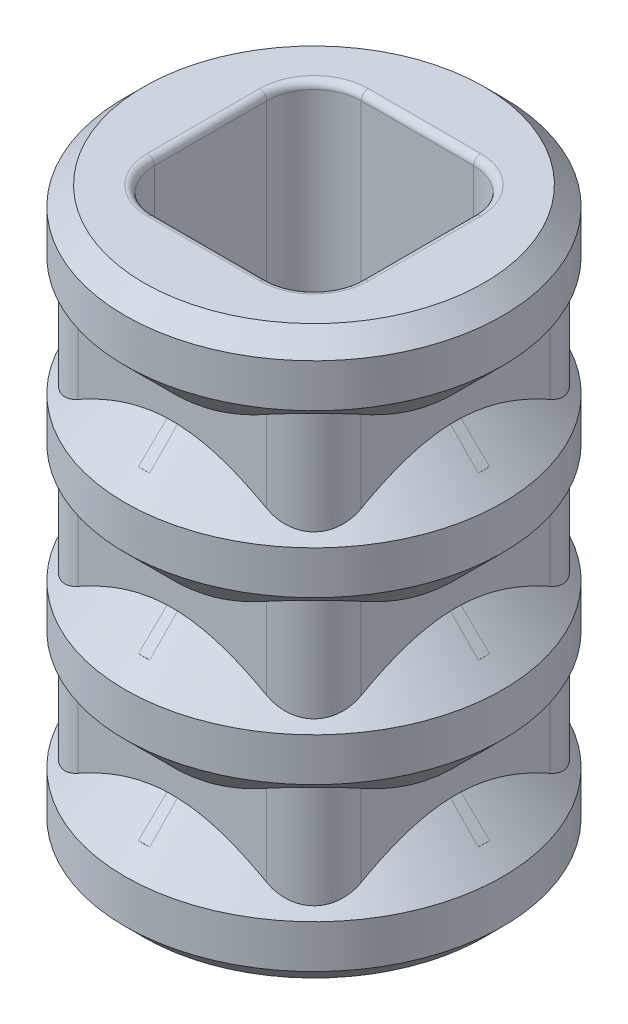
from build123d import *

# Parameters (mm, degrees)
BOSS_EXTRUDE1_DEPTH = 60
SKETCH4_W           = 5
SKETCH4_H           = 8.58
SKETCH4_H_2         = 8.57
CHAMFER1_SIZE       = 2
FILLET1_R           = 0.75
CHAMFER2_SIZE       = 2.99


with BuildPart() as part:
    # Sketch1 → Boss-Extrude1 (new body)
    with BuildSketch(Plane(origin=(0, 0, 0), x_dir=(1, 0, 0), z_dir=(0, 1, 0))):
        with BuildLine():
            Line((-10, -15), (10, -15))
            ThreePointArc((10, -15), (13.535533906, -13.535533906), (15, -10))
            Line((15, -10), (15, 10))
            ThreePointArc((15, 10), (13.535533906, 13.535533906), (10, 15))
            Line((10, 15), (-10, 15))
            ThreePointArc((-10, 15), (-13.535533906, 13.535533906), (-15, 10))
            Line((-15, 10), (-15, -10))
            ThreePointArc((-15, -10), (-13.535533906, -13.535533906), (-10, -15))
        make_face()
        with BuildLine():
            Line((-5.95, -10.95), (5.95, -10.95))
            ThreePointArc((5.95, -10.95), (9.485533906, -9.485533906), (10.95, -5.95))
            Line((10.95, -5.95), (10.95, 5.95))
            ThreePointArc((10.95, 5.95), (9.485533906, 9.485533906), (5.95, 10.95))
            Line((5.95, 10.95), (-5.95, 10.95))
            ThreePointArc((-5.95, 10.95), (-9.485533906, 9.485533906), (-10.95, 5.95))
            Line((-10.95, 5.95), (-10.95, -5.95))
            ThreePointArc((-10.95, -5.95), (-9.485533906, -9.485533906), (-5.95, -10.95))
        make_face(mode=Mode.SUBTRACT)
    extrude(amount=BOSS_EXTRUDE1_DEPTH)

    # Sketch4 → Revolve1 (revolve)
    with BuildSketch(Plane.XY, mode=Mode.PRIVATE) as revolve1_sk:
        with Locations((-17.5, 55.71)):
            Rectangle(SKETCH4_W, SKETCH4_H)
        with Locations((-17.5, 38.565)):
            Rectangle(SKETCH4_W, SKETCH4_H_2)
        with Locations((-17.5, 21.425)):
            Rectangle(SKETCH4_W, SKETCH4_H_2)
        with Locations((-17.5, 4.285)):
            Rectangle(SKETCH4_W, SKETCH4_H_2)
    revolve(revolve1_sk.sketch.rotate(Axis((0, -5.1019077, 0), (0, 1, 0)), 270), axis=Axis((0, -5.1019077, 0), (0, 1, 0)))

    # Chamfer1
    # the kernel refuses this chamfer: 2 mm, written as the material it takes off along each edge
    with BuildSketch(Plane(origin=(0, 8.57, 0), x_dir=(0, 0, -1), z_dir=(1, 0, 0))) as chamfer1_piece_1_section:
        Polygon((20 - CHAMFER1_SIZE, 0), (20, -CHAMFER1_SIZE), (20, 0), align=None)
    chamfer1_piece_1 = revolve(axis=Axis((0, 8.57, 0), (0, 1, 0)), mode=Mode.PRIVATE)
    chamfer1_piece_1 = chamfer1_piece_1 - Plane(origin=(-10, 7.597387384, -10), x_dir=(0, 0, -1), z_dir=(0, -1, 0)) * Cylinder(5, 81, mode=Mode.PRIVATE)
    chamfer1_piece_1 = chamfer1_piece_1 - Plane(origin=(10, 7.597387384, -10), x_dir=(1, 0, 0), z_dir=(0, -1, 0)) * Cylinder(5, 81, mode=Mode.PRIVATE)
    chamfer1_piece_1 = chamfer1_piece_1 - Plane(origin=(-10, 7.597387384, 10), x_dir=(-1, 0, 0), z_dir=(0, -1, 0)) * Cylinder(5, 81, mode=Mode.PRIVATE)
    chamfer1_piece_1 = chamfer1_piece_1 - Plane(origin=(10, 7.597387384, 10), x_dir=(0, 0, 1), z_dir=(0, -1, 0)) * Cylinder(5, 81, mode=Mode.PRIVATE)
    add(chamfer1_piece_1, mode=Mode.SUBTRACT)
    with BuildSketch(Plane(origin=(0, 0, 0), x_dir=(0, 0, -1), z_dir=(1, 0, 0))) as chamfer1_piece_2:
        Polygon((20 - CHAMFER1_SIZE, 0), (20, CHAMFER1_SIZE), (20, 0), align=None)
    revolve(axis=Axis((0, 0, 0), (0, 1, 0)), mode=Mode.SUBTRACT)
    with BuildSketch(Plane(origin=(0, 17.14, 0), x_dir=(0, 0, -1), z_dir=(1, 0, 0))) as chamfer1_piece_3_section:
        Polygon((20, CHAMFER1_SIZE), (20 - CHAMFER1_SIZE, 0), (20, 0), align=None)
    chamfer1_piece_3 = revolve(axis=Axis((0, 17.14, 0), (0, 1, 0)), mode=Mode.PRIVATE)
    chamfer1_piece_3 = chamfer1_piece_3 - Plane(origin=(10, 18.112612615, -10), x_dir=(1, 0, 0), z_dir=(0, -1, 0)) * Cylinder(5, 81, mode=Mode.PRIVATE)
    chamfer1_piece_3 = chamfer1_piece_3 - Plane(origin=(10, 18.112612615, 10), x_dir=(0, 0, 1), z_dir=(0, -1, 0)) * Cylinder(5, 81, mode=Mode.PRIVATE)
    chamfer1_piece_3 = chamfer1_piece_3 - Plane(origin=(-10, 18.112612615, 10), x_dir=(-1, 0, 0), z_dir=(0, -1, 0)) * Cylinder(5, 81, mode=Mode.PRIVATE)
    chamfer1_piece_3 = chamfer1_piece_3 - Plane(origin=(-10, 18.112612615, -10), x_dir=(0, 0, -1), z_dir=(0, -1, 0)) * Cylinder(5, 81, mode=Mode.PRIVATE)
    add(chamfer1_piece_3, mode=Mode.SUBTRACT)
    with BuildSketch(Plane(origin=(0, 25.71, 0), x_dir=(0, 0, -1), z_dir=(1, 0, 0))) as chamfer1_piece_4_section:
        Polygon((20 - CHAMFER1_SIZE, 0), (20, -CHAMFER1_SIZE), (20, 0), align=None)
    chamfer1_piece_4 = revolve(axis=Axis((0, 25.71, 0), (0, 1, 0)), mode=Mode.PRIVATE)
    chamfer1_piece_4 = chamfer1_piece_4 - Plane(origin=(-10, 24.737387384, -10), x_dir=(0, 0, -1), z_dir=(0, -1, 0)) * Cylinder(5, 81, mode=Mode.PRIVATE)
    chamfer1_piece_4 = chamfer1_piece_4 - Plane(origin=(10, 24.737387384, -10), x_dir=(1, 0, 0), z_dir=(0, -1, 0)) * Cylinder(5, 81, mode=Mode.PRIVATE)
    chamfer1_piece_4 = chamfer1_piece_4 - Plane(origin=(-10, 24.737387384, 10), x_dir=(-1, 0, 0), z_dir=(0, -1, 0)) * Cylinder(5, 81, mode=Mode.PRIVATE)
    chamfer1_piece_4 = chamfer1_piece_4 - Plane(origin=(10, 24.737387384, 10), x_dir=(0, 0, 1), z_dir=(0, -1, 0)) * Cylinder(5, 81, mode=Mode.PRIVATE)
    add(chamfer1_piece_4, mode=Mode.SUBTRACT)
    with BuildSketch(Plane(origin=(0, 34.28, 0), x_dir=(0, 0, -1), z_dir=(1, 0, 0))) as chamfer1_piece_5_section:
        Polygon((20, CHAMFER1_SIZE), (20 - CHAMFER1_SIZE, 0), (20, 0), align=None)
    chamfer1_piece_5 = revolve(axis=Axis((0, 34.28, 0), (0, 1, 0)), mode=Mode.PRIVATE)
    chamfer1_piece_5 = chamfer1_piece_5 - Plane(origin=(10, 35.252612615, -10), x_dir=(1, 0, 0), z_dir=(0, -1, 0)) * Cylinder(5, 81, mode=Mode.PRIVATE)
    chamfer1_piece_5 = chamfer1_piece_5 - Plane(origin=(10, 35.252612615, 10), x_dir=(0, 0, 1), z_dir=(0, -1, 0)) * Cylinder(5, 81, mode=Mode.PRIVATE)
    chamfer1_piece_5 = chamfer1_piece_5 - Plane(origin=(-10, 35.252612615, 10), x_dir=(-1, 0, 0), z_dir=(0, -1, 0)) * Cylinder(5, 81, mode=Mode.PRIVATE)
    chamfer1_piece_5 = chamfer1_piece_5 - Plane(origin=(-10, 35.252612615, -10), x_dir=(0, 0, -1), z_dir=(0, -1, 0)) * Cylinder(5, 81, mode=Mode.PRIVATE)
    add(chamfer1_piece_5, mode=Mode.SUBTRACT)
    with BuildSketch(Plane(origin=(0, 42.85, 0), x_dir=(0, 0, -1), z_dir=(1, 0, 0))) as chamfer1_piece_6_section:
        Polygon((20 - CHAMFER1_SIZE, 0), (20, -CHAMFER1_SIZE), (20, 0), align=None)
    chamfer1_piece_6 = revolve(axis=Axis((0, 42.85, 0), (0, 1, 0)), mode=Mode.PRIVATE)
    chamfer1_piece_6 = chamfer1_piece_6 - Plane(origin=(-10, 41.877387384, -10), x_dir=(0, 0, -1), z_dir=(0, -1, 0)) * Cylinder(5, 81, mode=Mode.PRIVATE)
    chamfer1_piece_6 = chamfer1_piece_6 - Plane(origin=(-10, 41.877387384, 10), x_dir=(-1, 0, 0), z_dir=(0, -1, 0)) * Cylinder(5, 81, mode=Mode.PRIVATE)
    chamfer1_piece_6 = chamfer1_piece_6 - Plane(origin=(10, 41.877387384, 10), x_dir=(0, 0, 1), z_dir=(0, -1, 0)) * Cylinder(5, 81, mode=Mode.PRIVATE)
    chamfer1_piece_6 = chamfer1_piece_6 - Plane(origin=(10, 41.877387384, -10), x_dir=(1, 0, 0), z_dir=(0, -1, 0)) * Cylinder(5, 81, mode=Mode.PRIVATE)
    add(chamfer1_piece_6, mode=Mode.SUBTRACT)
    with BuildSketch(Plane(origin=(0, 51.42, 0), x_dir=(0, 0, -1), z_dir=(1, 0, 0))) as chamfer1_piece_7_section:
        Polygon((20, CHAMFER1_SIZE), (20 - CHAMFER1_SIZE, 0), (20, 0), align=None)
    chamfer1_piece_7 = revolve(axis=Axis((0, 51.42, 0), (0, 1, 0)), mode=Mode.PRIVATE)
    chamfer1_piece_7 = chamfer1_piece_7 - Plane(origin=(-10, 52.392612615, -10), x_dir=(0, 0, -1), z_dir=(0, -1, 0)) * Cylinder(5, 81, mode=Mode.PRIVATE)
    chamfer1_piece_7 = chamfer1_piece_7 - Plane(origin=(10, 52.392612615, -10), x_dir=(1, 0, 0), z_dir=(0, -1, 0)) * Cylinder(5, 81, mode=Mode.PRIVATE)
    chamfer1_piece_7 = chamfer1_piece_7 - Plane(origin=(10, 52.392612615, 10), x_dir=(0, 0, 1), z_dir=(0, -1, 0)) * Cylinder(5, 81, mode=Mode.PRIVATE)
    chamfer1_piece_7 = chamfer1_piece_7 - Plane(origin=(-10, 52.392612615, 10), x_dir=(-1, 0, 0), z_dir=(0, -1, 0)) * Cylinder(5, 81, mode=Mode.PRIVATE)
    add(chamfer1_piece_7, mode=Mode.SUBTRACT)
    with BuildSketch(Plane(origin=(0, 60, 0), x_dir=(0, 0, -1), z_dir=(1, 0, 0))) as chamfer1_piece_8:
        Polygon((20 - CHAMFER1_SIZE, 0), (20, -CHAMFER1_SIZE), (20, 0), align=None)
    revolve(axis=Axis((0, 60, 0), (0, 1, 0)), mode=Mode.SUBTRACT)

    # Fillet1
    fillet1_edges = [part.edges().sort_by_distance(p)[0] for p in [
        (-9.485533906, 0, 9.485533906),
        (0, 0, 10.95),
        (9.485533906, 0, 9.485533906),
        (10.95, 0, 0),
        (9.485533906, 0, -9.485533906),
        (0, 0, -10.95),
        (-9.485533906, 0, -9.485533906),
        (-10.95, 0, 0),
        (-9.485533906, 60, 9.485533906),
        (0, 60, 10.95),
        (9.485533906, 60, 9.485533906),
        (10.95, 60, 0),
        (9.485533906, 60, -9.485533906),
        (0, 60, -10.95),
        (-9.485533906, 60, -9.485533906),
        (-10.95, 60, 0),
    ]]
    fillet(fillet1_edges, radius=FILLET1_R)

    # Chamfer2
    chamfer2_edges = [part.edges().sort_by_distance(p)[0] for p in [
        (-15, 8.57, 0),
        (0, 8.57, -15),
        (15, 8.57, 0),
        (0, 8.57, 15),
        (15, 17.14, 0),
        (0, 17.14, -15),
        (-15, 17.14, 0),
        (0, 17.14, 15),
        (-15, 25.71, 0),
        (0, 25.71, -15),
        (15, 25.71, 0),
        (0, 25.71, 15),
        (15, 34.28, 0),
        (0, 34.28, -15),
        (-15, 34.28, 0),
        (0, 34.28, 15),
        (-15, 42.85, 0),
        (0, 42.85, -15),
        (15, 42.85, 0),
        (0, 42.85, 15),
        (15, 51.42, 0),
        (0, 51.42, -15),
        (-15, 51.42, 0),
        (0, 51.42, 15),
    ]]
    chamfer(chamfer2_edges, length=CHAMFER2_SIZE)


solid = part.part
